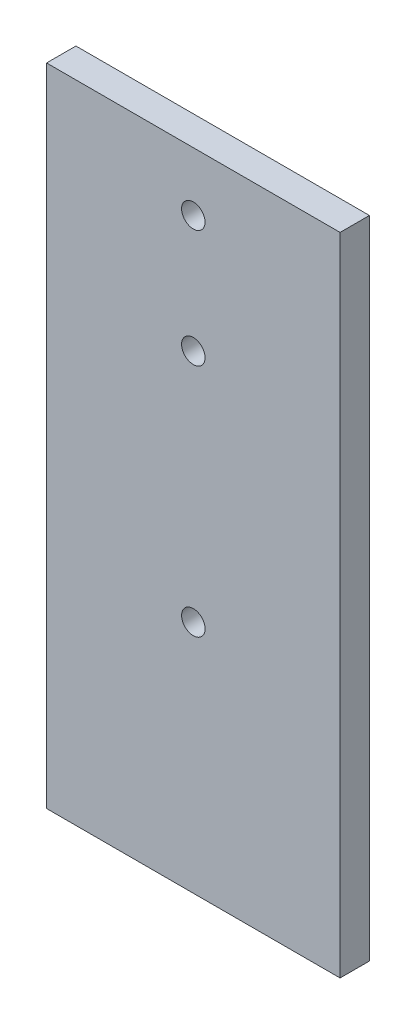
from build123d import *

# Parameters (mm, degrees)
ESQUISSE1_R        = 2
BOSS_EXTRU_1_DEPTH = 5


with BuildPart() as part:
    # Esquisse1 → Boss.-Extru.1 (new body)
    with BuildSketch(Plane.XY):
        Polygon((25, 50), (25, 0), (25, -60), (-25, -60), (-25, 0), (-25, 50), align=None)
        with Locations((0, 20)):
            Circle(ESQUISSE1_R, mode=Mode.SUBTRACT)
        with Locations((0, -20)):
            Circle(ESQUISSE1_R, mode=Mode.SUBTRACT)
        with Locations((0, 40)):
            Circle(ESQUISSE1_R, mode=Mode.SUBTRACT)
    extrude(amount=BOSS_EXTRU_1_DEPTH)


solid = part.part
